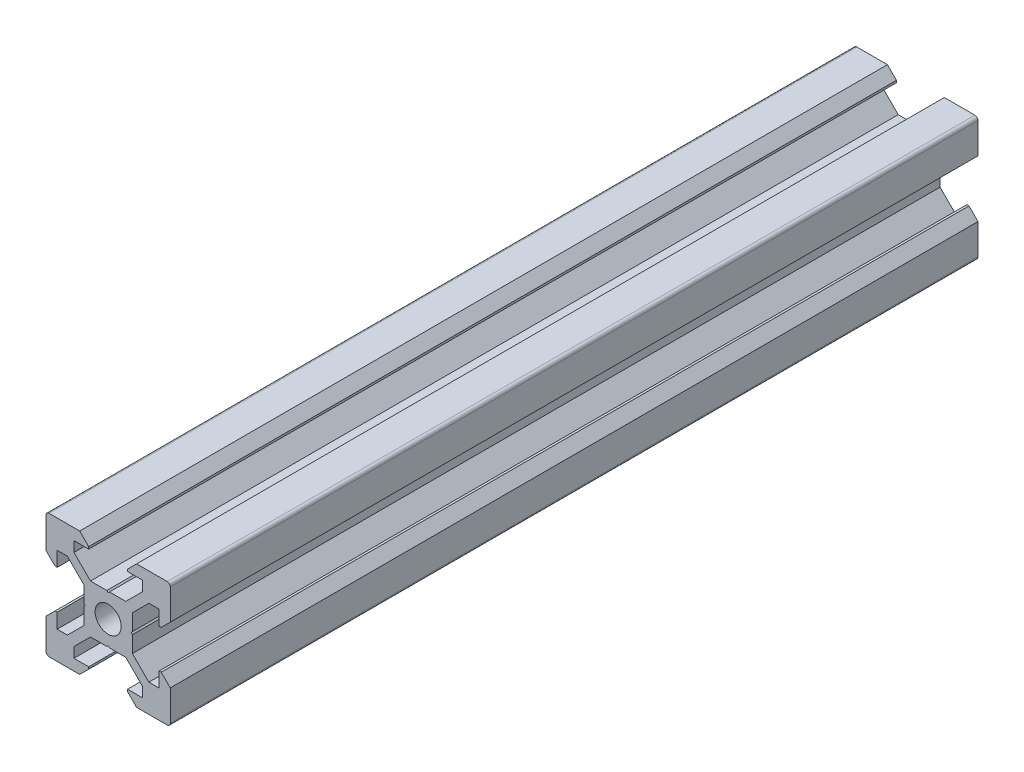
from build123d import *

# Parameters (mm, degrees)
V_SLOT_START                           = -5.085646751
V_SLOT_20X20X500_LINEAR_RAIL_OUTLINE_R = 2.1
V_SLOT_20X20X500_LINEAR_RAIL_DEPTH     = 500
SKETCH1_W                              = 20
SKETCH1_H                              = 370
CUT_EXTRUDE1_DEPTH                     = 497.589794047


# Read off the part's stored shape, not the designer's step: V-Slot 20x20x500 Linear Rail
with BuildPart() as part:
    # V-Slot 20x20x500 Linear Rail outline → V-Slot 20x20x500 Linear Rail (new body)
    with BuildSketch(Plane.XY.offset(V_SLOT_START)):
        with BuildLine():
            Line((-21.613469268, 24.462926439), (-21.613469268, 27.092266268))
            Line((-21.613469268, 27.092266268), (-21.823469268, 27.302266268))
            Line((-21.823469268, 27.302266268), (-21.613469268, 27.512266268))
            Line((-21.613469268, 27.512266268), (-21.613469268, 30.141606096))
            Line((-21.613469268, 30.141606096), (-18.952809096, 32.802266268))
            Line((-18.952809096, 32.802266268), (-17.313469268, 32.802266268))
            Line((-17.313469268, 32.802266268), (-17.313469268, 30.427266268))
            Line((-17.313469268, 30.427266268), (-16.968469268, 30.427266268))
            Line((-16.968469268, 30.427266268), (-15.513469268, 31.882266268))
            Line((-15.513469268, 31.882266268), (-15.513469268, 36.802266268))
            ThreePointArc((-15.513469268, 36.802266268), (-15.659915878, 37.155819658), (-16.013469268, 37.302266268))
            Line((-16.013469268, 37.302266268), (-20.933469268, 37.302266268))
            Line((-20.933469268, 37.302266268), (-22.388469268, 35.847266268))
            Line((-22.388469268, 35.847266268), (-22.388469268, 35.502266268))
            Line((-22.388469268, 35.502266268), (-20.013469268, 35.502266268))
            Line((-20.013469268, 35.502266268), (-20.013469268, 33.862926439))
            Line((-20.013469268, 33.862926439), (-22.67412944, 31.202266268))
            Line((-22.67412944, 31.202266268), (-25.303469268, 31.202266268))
            Line((-25.303469268, 31.202266268), (-25.513469268, 30.992266268))
            Line((-25.513469268, 30.992266268), (-25.723469268, 31.202266268))
            Line((-25.723469268, 31.202266268), (-28.352809096, 31.202266268))
            Line((-28.352809096, 31.202266268), (-31.013469268, 33.862926439))
            Line((-31.013469268, 33.862926439), (-31.013469268, 35.502266268))
            Line((-31.013469268, 35.502266268), (-28.638469268, 35.502266268))
            Line((-28.638469268, 35.502266268), (-28.638469268, 35.847266268))
            Line((-28.638469268, 35.847266268), (-30.093469268, 37.302266268))
            Line((-30.093469268, 37.302266268), (-35.013469268, 37.302266268))
            ThreePointArc((-35.013469268, 37.302266268), (-35.367022659, 37.155819658), (-35.513469268, 36.802266268))
            Line((-35.513469268, 36.802266268), (-35.513469268, 31.882266268))
            Line((-35.513469268, 31.882266268), (-34.058469268, 30.427266268))
            Line((-34.058469268, 30.427266268), (-33.713469268, 30.427266268))
            Line((-33.713469268, 30.427266268), (-33.713469268, 32.802266268))
            Line((-33.713469268, 32.802266268), (-32.07412944, 32.802266268))
            Line((-32.07412944, 32.802266268), (-29.413469268, 30.141606096))
            Line((-29.413469268, 30.141606096), (-29.413469268, 27.512266268))
            Line((-29.413469268, 27.512266268), (-29.203469268, 27.302266268))
            Line((-29.203469268, 27.302266268), (-29.413469268, 27.092266268))
            Line((-29.413469268, 27.092266268), (-29.413469268, 24.462926439))
            Line((-29.413469268, 24.462926439), (-32.07412944, 21.802266268))
            Line((-32.07412944, 21.802266268), (-33.713469268, 21.802266268))
            Line((-33.713469268, 21.802266268), (-33.713469268, 24.177266268))
            Line((-33.713469268, 24.177266268), (-34.058469268, 24.177266268))
            Line((-34.058469268, 24.177266268), (-35.513469268, 22.722266268))
            Line((-35.513469268, 22.722266268), (-35.513469268, 17.802266268))
            ThreePointArc((-35.513469268, 17.802266268), (-35.367022659, 17.448712877), (-35.013469268, 17.302266268))
            Line((-35.013469268, 17.302266268), (-30.093469268, 17.302266268))
            Line((-30.093469268, 17.302266268), (-28.638469268, 18.757266268))
            Line((-28.638469268, 18.757266268), (-28.638469268, 19.102266268))
            Line((-28.638469268, 19.102266268), (-31.013469268, 19.102266268))
            Line((-31.013469268, 19.102266268), (-31.013469268, 20.741606096))
            Line((-31.013469268, 20.741606096), (-28.352809096, 23.402266268))
            Line((-28.352809096, 23.402266268), (-25.723469268, 23.402266268))
            Line((-25.723469268, 23.402266268), (-25.513469268, 23.612266268))
            Line((-25.513469268, 23.612266268), (-25.303469268, 23.402266268))
            Line((-25.303469268, 23.402266268), (-22.67412944, 23.402266268))
            Line((-22.67412944, 23.402266268), (-20.013469268, 20.741606096))
            Line((-20.013469268, 20.741606096), (-20.013469268, 19.102266268))
            Line((-20.013469268, 19.102266268), (-22.388469268, 19.102266268))
            Line((-22.388469268, 19.102266268), (-22.388469268, 18.757266268))
            Line((-22.388469268, 18.757266268), (-20.933469268, 17.302266268))
            Line((-20.933469268, 17.302266268), (-16.013469268, 17.302266268))
            ThreePointArc((-16.013469268, 17.302266268), (-15.659915877, 17.448712878), (-15.513469268, 17.802266268))
            Line((-15.513469268, 17.802266268), (-15.513469268, 22.722266268))
            Line((-15.513469268, 22.722266268), (-16.968469268, 24.177266268))
            Line((-16.968469268, 24.177266268), (-17.313469268, 24.177266268))
            Line((-17.313469268, 24.177266268), (-17.313469268, 21.802266268))
            Line((-17.313469268, 21.802266268), (-18.952809096, 21.802266268))
            Line((-18.952809096, 21.802266268), (-21.613469268, 24.462926439))
        make_face()
        with Locations((-25.513469268, 27.302266268)):
            Circle(V_SLOT_20X20X500_LINEAR_RAIL_OUTLINE_R, mode=Mode.SUBTRACT)
    extrude(amount=V_SLOT_20X20X500_LINEAR_RAIL_DEPTH)

    # Sketch1 → Cut-Extrude1 (cut, through all)
    with BuildSketch(Plane(origin=(0, 37.302266268, 0), x_dir=(1, 0, 0), z_dir=(0, 1, 0))):
        with Locations((-25.513469268, -309.914353249)):
            Rectangle(SKETCH1_W, SKETCH1_H)
    extrude(amount=-CUT_EXTRUDE1_DEPTH, mode=Mode.SUBTRACT)


solid = part.part
